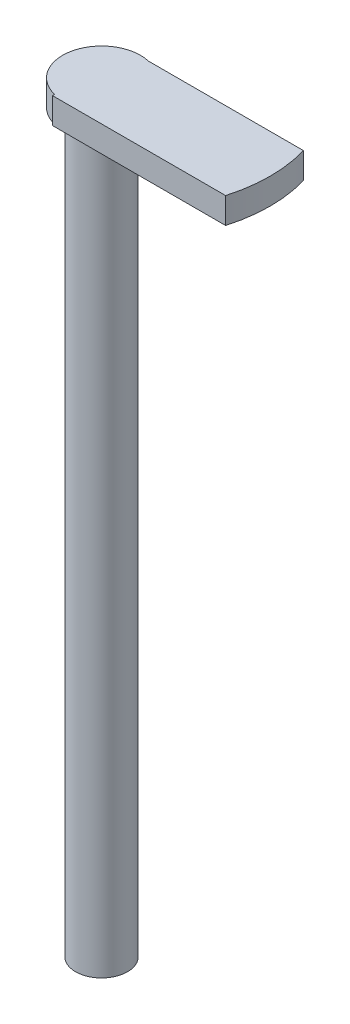
from build123d import *

# Parameters (mm, degrees)
SKETCH1_R           = 3
BOSS_EXTRUDE2_DEPTH = 85
SKETCH2_R           = 4.5
BOSS_EXTRUDE3_DEPTH = 3
BOSS_EXTRUDE5_DEPTH = 3


with BuildPart() as part:
    # Sketch1 → Boss-Extrude2 (new body)
    with BuildSketch(Plane(origin=(0, 0, 0), x_dir=(1, 0, 0), z_dir=(0, 1, 0))):
        Circle(SKETCH1_R)
    extrude(amount=BOSS_EXTRUDE2_DEPTH)

    # Sketch2 → Boss-Extrude3 (add)
    with BuildSketch(Plane(origin=(0, 85, 0), x_dir=(1, 0, 0), z_dir=(0, 1, 0))):
        Circle(SKETCH2_R)
    extrude(amount=BOSS_EXTRUDE3_DEPTH)

    # Sketch3 → Boss-Extrude5 (add)
    with BuildSketch(Plane(origin=(0, 88, 0), x_dir=(1, 0, 0), z_dir=(0, 1, 0))):
        with BuildLine():
            Line((-1.041954443, 4.377708412), (18.958045557, 4.377708412))
            ThreePointArc((18.958045557, 4.377708412), (19.6023308, -0.122251052), (18.95861205, -4.622291588))
            Line((18.95861205, -4.622291588), (-1.041954443, -4.622291588))
            Line((-1.041954443, -4.622291588), (-1.041954443, 4.377708412))
        make_face()
    extrude(amount=-BOSS_EXTRUDE5_DEPTH)


solid = part.part
